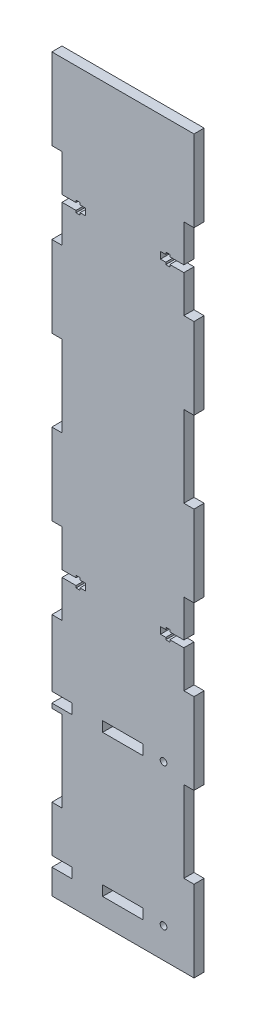
from build123d import *

# Parameters (mm, degrees)
SKETCH2_W           = 6.35
SKETCH2_H           = 88.9
BOSS_EXTRUDE1_DEPTH = 457.2
SKETCH4_W           = 6.35
SKETCH4_H           = 50.8
CUT_EXTRUDE1_DEPTH  = 460.399570091
SKETCH5_W           = 25.4
SKETCH5_H           = 6.35
CUT_EXTRUDE2_DEPTH  = 460.399570091
SKETCH6_R           = 2.0955
CUT_EXTRUDE3_DEPTH  = 460.399570091
SKETCH7_W           = 12.7
SKETCH7_H           = 6.35
CUT_EXTRUDE4_DEPTH  = 10
SKETCH8_W           = 12.7
SKETCH8_H           = 6.35
CUT_EXTRUDE5_DEPTH  = 460.399570091
CUT_EXTRUDE6_DEPTH  = 460.399570091


with BuildPart() as part:
    # Sketch2 → Boss-Extrude1 (new body)
    with BuildSketch(Plane.ZX):
        with Locations((41.275, 0)):
            Rectangle(SKETCH2_W, SKETCH2_H)
    extrude(amount=BOSS_EXTRUDE1_DEPTH)

    # Sketch4 → Cut-Extrude1 (cut, through all)
    with BuildSketch(Plane.XY.offset(44.45)):
        with Locations((41.275, 381)):
            Rectangle(SKETCH4_W, SKETCH4_H)
        with Locations((41.275, 279.4)):
            Rectangle(SKETCH4_W, SKETCH4_H)
        with Locations((41.275, 177.8)):
            Rectangle(SKETCH4_W, SKETCH4_H)
        with Locations((41.275, 76.2)):
            Rectangle(SKETCH4_W, SKETCH4_H)
    cut_extrude1 = extrude(amount=-CUT_EXTRUDE1_DEPTH, mode=Mode.SUBTRACT)

    # Mirror1: Cut-Extrude1 across plane
    add(cut_extrude1.mirror(Plane(origin=(0, 0, 0), x_dir=(0, 0, 1), z_dir=(1, 0, 0))), mode=Mode.SUBTRACT)

    # Sketch5 → Cut-Extrude2 (cut, through all)
    with BuildSketch(Plane(origin=(0, 0, 38.1), x_dir=(-1, 0, 0), z_dir=(0, 0, -1))):
        with Locations((0, 107.6625)):
            Rectangle(SKETCH5_W, SKETCH5_H)
        with Locations((0, 18.7625)):
            Rectangle(SKETCH5_W, SKETCH5_H)
    extrude(amount=-CUT_EXTRUDE2_DEPTH, mode=Mode.SUBTRACT)

    # Sketch6 → Cut-Extrude3 (cut, through all)
    with BuildSketch(Plane.XY.offset(44.45)):
        with Locations((25.4, 107.6625)):
            Circle(SKETCH6_R)
        with Locations((25.4, 18.7625)):
            Circle(SKETCH6_R)
    extrude(amount=-CUT_EXTRUDE3_DEPTH, mode=Mode.SUBTRACT)

    # Sketch7 → Cut-Extrude4 (cut)
    with BuildSketch(Plane(origin=(0, 0, 38.1), x_dir=(-1, 0, 0), z_dir=(0, 0, -1))):
        with Locations((38.1, 107.6625)):
            Rectangle(SKETCH7_W, SKETCH7_H)
    extrude(amount=-CUT_EXTRUDE4_DEPTH, mode=Mode.SUBTRACT)

    # Sketch8 → Cut-Extrude5 (cut, through all)
    with BuildSketch(Plane(origin=(0, 0, 38.1), x_dir=(-1, 0, 0), z_dir=(0, 0, -1))):
        with Locations((38.1, 18.7625)):
            Rectangle(SKETCH8_W, SKETCH8_H)
    extrude(amount=-CUT_EXTRUDE5_DEPTH, mode=Mode.SUBTRACT)

    # Sketch9 → Cut-Extrude6 (cut, through all)
    with BuildSketch(Plane.XY.offset(44.45)):
        Polygon((-38.1, 383.0955), (-38.1, 378.9045), (-29.337, 378.9045), (-29.337, 377.571), (-26.797, 377.571), (-26.797, 378.9045), (-23.495, 378.9045), (-23.495, 383.0955), (-26.797, 383.0955), (-26.797, 384.429), (-29.337, 384.429), (-29.337, 383.0955), align=None)
        Polygon((-38.1, 179.8955), (-38.1, 175.7045), (-29.337, 175.7045), (-29.337, 174.371), (-26.797, 174.371), (-26.797, 175.7045), (-23.495, 175.7045), (-23.495, 179.8955), (-26.797, 179.8955), (-26.797, 181.229), (-29.337, 181.229), (-29.337, 179.8955), align=None)
        Polygon((38.1, 383.0955), (38.1, 378.9045), (29.337, 378.9045), (29.337, 377.571), (26.797, 377.571), (26.797, 378.9045), (23.495, 378.9045), (23.495, 383.0955), (26.797, 383.0955), (26.797, 384.429), (29.337, 384.429), (29.337, 383.0955), align=None)
        Polygon((38.1, 179.8955), (38.1, 175.7045), (29.337, 175.7045), (29.337, 174.371), (26.797, 174.371), (26.797, 175.7045), (23.495, 175.7045), (23.495, 179.8955), (26.797, 179.8955), (26.797, 181.229), (29.337, 181.229), (29.337, 179.8955), align=None)
    extrude(amount=-CUT_EXTRUDE6_DEPTH, mode=Mode.SUBTRACT)


solid = part.part
